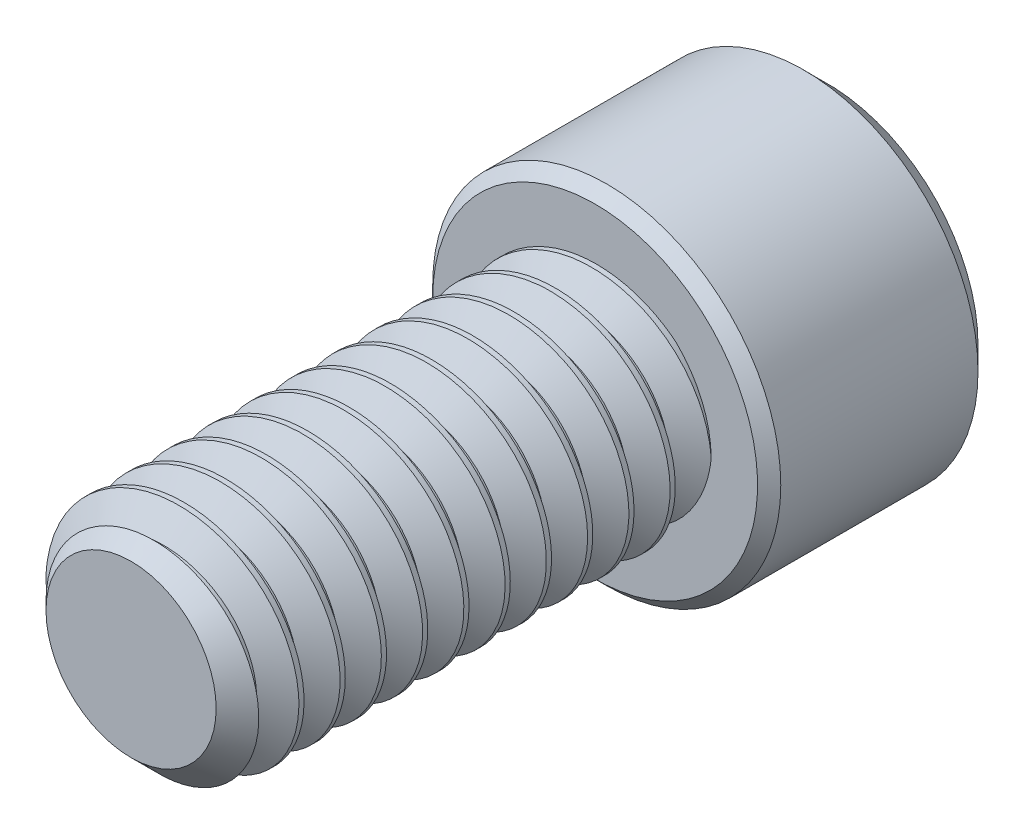
from build123d import *

# Parameters (mm, degrees)
SKETCH1_R          = 3.96875
EXTRUDE1_DEPTH     = 15.875
CHAMFER3_SIZE      = 1.058333333
CUT_SWEEP1_PITCH   = 1.411111111
SKETCH6_R          = 5.953125
EXTRUDE2_DEPTH     = 7.9375
CUT_EXTRUDE1_DEPTH = 4.7625
SKETCH8_R          = 3.666174209
CUT_EXTRUDE2_DEPTH = 0.79375
CUT_EXTRUDE2_DRAFT = -45
CHAMFER1_SIZE      = 0.79375
CHAMFER2_SIZE      = 0.396875


with BuildPart() as part:
    # Sketch1 → Extrude1 (new body)
    with BuildSketch(Plane.XY):
        Circle(SKETCH1_R)
    extrude(amount=-EXTRUDE1_DEPTH)

    # Chamfer3
    chamfer3_edges = [part.edges().sort_by_distance(p)[0] for p in [
        (-3.96875, 0, 0),
    ]]
    chamfer(chamfer3_edges, length=CHAMFER3_SIZE)

    # Cut-Sweep1: the profile of Sketch3 profile screwed along a right-hand helix of 12.25 turns, 6 arcs to a turn; built about Z, then put on its axis
    cut_sweep1_z = Axis((0, 0, 0), (0, 0, 1))
    cut_sweep1_corners = [(3.96905, 0, -1.234895427), (3.052206448, 0, -0.705555556), (3.052206448, 0, -0.529166667), (3.96905, 0, 0.000173205)]
    with BuildLine(mode=Mode.PRIVATE) as cut_sweep1_profile:
        Line(cut_sweep1_corners[0], cut_sweep1_corners[1])
        Line(cut_sweep1_corners[1], cut_sweep1_corners[2])
        Line(cut_sweep1_corners[2], cut_sweep1_corners[3])
        Line(cut_sweep1_corners[3], cut_sweep1_corners[0])
    cut_sweep1_cap = Face(cut_sweep1_profile.wire())
    cut_sweep1_turn_angles = [0, 30, 60, 90, 120, 150, 180, 210, 240, 270, 300, 330, 360]
    cut_sweep1_turn_weights = [1, 0.8660254037844387, 1, 0.8660254037844387, 1, 0.8660254037844387, 1, 0.8660254037844387, 1, 0.8660254037844387, 1, 0.8660254037844387, 1]
    cut_sweep1_turn_rails = [Edge.make_bspline([Vector(p[0], p[1], 0).rotate(cut_sweep1_z, cut_sweep1_turn_angles[k]) / cut_sweep1_turn_weights[k] + Vector(0, 0, p[2] + CUT_SWEEP1_PITCH * cut_sweep1_turn_angles[k] / 360) for k in range(13)], [0, 0, 0, 1, 1, 2, 2, 3, 3, 4, 4, 5, 5, 6, 6, 6], 2, cut_sweep1_turn_weights) for p in cut_sweep1_corners]
    cut_sweep1_turn_sides = [Face.make_surface_from_curves(cut_sweep1_turn_rails[p[0]], cut_sweep1_turn_rails[p[1]]) for p in [(0, 1), (1, 2), (2, 3), (3, 0)]]
    cut_sweep1_last_angles = [4320, 4350, 4380, 4395, 4410]
    cut_sweep1_last_weights = [1, 0.8660254037844387, 1, 0.9659258262890108, 1]
    cut_sweep1_last_rails = [Edge.make_bspline([Vector(p[0], p[1], 0).rotate(cut_sweep1_z, cut_sweep1_last_angles[k]) / cut_sweep1_last_weights[k] + Vector(0, 0, p[2] + CUT_SWEEP1_PITCH * cut_sweep1_last_angles[k] / 360) for k in range(5)], [0, 0, 0, 1, 1, 2, 2, 2], 2, cut_sweep1_last_weights) for p in cut_sweep1_corners]
    cut_sweep1_last_sides = [Face.make_surface_from_curves(cut_sweep1_last_rails[p[0]], cut_sweep1_last_rails[p[1]]) for p in [(0, 1), (1, 2), (2, 3), (3, 0)]]
    cut_sweep1 = Plane(origin=(0, 0, 0), x_dir=(0, 1, 0), z_dir=(0, 0, -1)) * Solid(Shell([*[p.moved(Location((0, 0, CUT_SWEEP1_PITCH * i))) for i in range(12) for p in cut_sweep1_turn_sides], *cut_sweep1_last_sides, cut_sweep1_cap, cut_sweep1_cap.rotate(cut_sweep1_z, 4410).moved(Location((0, 0, CUT_SWEEP1_PITCH * 4410 / 360)))]))
    add(cut_sweep1, mode=Mode.SUBTRACT)

    # Sketch6 → Extrude2 (add)
    with BuildSketch(Plane(origin=(0, 0, -15.875), x_dir=(-1, 0, 0), z_dir=(0, 0, -1))):
        Circle(SKETCH6_R)
    extrude(amount=EXTRUDE2_DEPTH)

    # Sketch7 → Cut-Extrude1 (cut)
    with BuildSketch(Plane(origin=(0, 0, -23.8125), x_dir=(-1, 0, 0), z_dir=(0, 0, -1))):
        Polygon((0, 3.666174209), (-3.175, 1.833087105), (-3.175, -1.833087105), (0, -3.666174209), (3.175, -1.833087105), (3.175, 1.833087105), align=None)
    extrude(amount=-CUT_EXTRUDE1_DEPTH, mode=Mode.SUBTRACT)


with BuildPart() as cut_extrude2_tool:
    # Sketch8 → Cut-Extrude2 (with draft: the straight prism first)
    with BuildSketch(Plane(origin=(0, 0, -23.8125), x_dir=(-1, 0, 0), z_dir=(0, 0, -1))):
        Circle(SKETCH8_R)
    extrude(amount=-CUT_EXTRUDE2_DEPTH)
    # Cut-Extrude2: the draft: its side faces are tilted about the plane it starts from
    cut_extrude2_sides = [cut_extrude2_tool.faces().sort_by_distance(p)[0] for p in [
        (3.666174209, 0, -23.415625),
    ]]
    draft(cut_extrude2_sides, Plane(origin=(0, 0, -23.8125), x_dir=(-1, 0, 0), z_dir=(0, 0, -1)), CUT_EXTRUDE2_DRAFT)


with BuildPart() as part_1:
    add(part.part)

    # Cut-Extrude2: cut by cut_extrude2_tool
    add(cut_extrude2_tool.part, mode=Mode.SUBTRACT)

    # Chamfer1
    chamfer1_edges = [part_1.edges().sort_by_distance(p)[0] for p in [
        (5.953125, 0, -23.8125),
    ]]
    chamfer(chamfer1_edges, length=CHAMFER1_SIZE)

    # Chamfer2
    chamfer2_edges = [part_1.edges().sort_by_distance(p)[0] for p in [
        (5.953125, 0, -15.875),
    ]]
    chamfer(chamfer2_edges, length=CHAMFER2_SIZE)


solid = part_1.part
